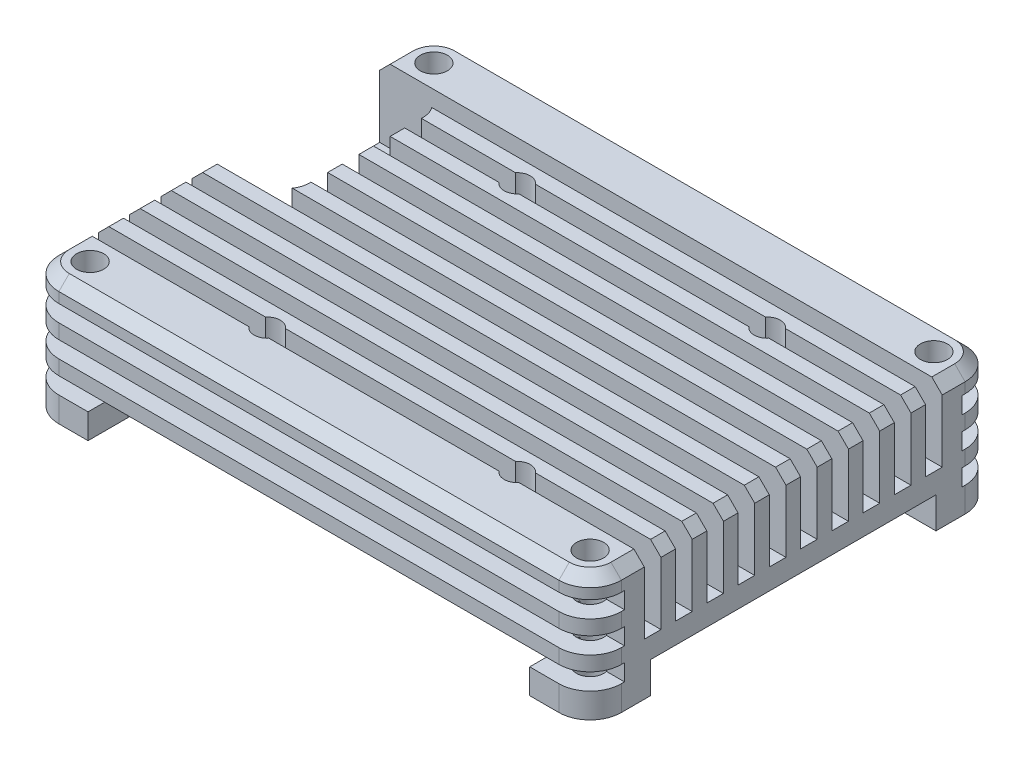
from build123d import *

# Parameters (mm, degrees)
SKIZZE1_W                         = 5.8
SKIZZE1_H                         = 5.8
AUFSATZ_LINEAR_AUSTRAGEN1_DEPTH   = 3
AUFSATZ_LINEAR_AUSTRAGEN1_2_DEPTH = 3
AUFSATZ_LINEAR_AUSTRAGEN1_3_DEPTH = 3
AUFSATZ_LINEAR_AUSTRAGEN1_4_DEPTH = 3
SKIZZE1_4_W                       = 15
SKIZZE1_4_H                       = 15
SKIZZE1_4_W_2                     = 10
SKIZZE1_4_W_3                     = 5.8
SKIZZE1_4_H_2                     = 5.8
AUFSATZ_LINEAR_AUSTRAGEN2_DEPTH   = 9
SKIZZE1_5_W                       = 10
SKIZZE1_5_H                       = 15
AUFSATZ_LINEAR_AUSTRAGEN3_DEPTH   = 2.2
SKIZZE1_6_W                       = 15
SKIZZE1_6_H                       = 15
AUFSATZ_LINEAR_AUSTRAGEN4_DEPTH   = 0.4
F_2_6_2_6_DURCHMESSER_BOHRUNG1_D  = 2.6
VERRUNDUNG1_R                     = 2
SKIZZE6_W                         = 1.6
SKIZZE6_H                         = 7
SKIZZE6_W_2                       = 3.3
SKIZZE6_H_2                       = 1.6
SCHNITT_LINEAR_AUSTRAGEN2_DEPTH   = 59.653644388
VERRUNDUNG2_R                     = 3
FASE1_SIZE                        = 1


# Read off the part's stored shape, not the designer's step: M3 Gewindebohrung2
with BuildPart() as part:
    # Skizze1 → Aufsatz-Linear austragen1 (new body)
    with BuildSketch(Plane(origin=(0, 3, 0), x_dir=(1, 0, 0), z_dir=(0, 1, 0))):
        with Locations((-24.1, -16.6)):
            Rectangle(SKIZZE1_W, SKIZZE1_H)
    extrude(amount=-AUFSATZ_LINEAR_AUSTRAGEN1_DEPTH)



with BuildPart() as body_2:
    # Skizze1 → Aufsatz-Linear austragen1 2 (new body)
    with BuildSketch(Plane(origin=(0, 3, 0), x_dir=(1, 0, 0), z_dir=(0, 1, 0))):
        with Locations((-24.1, 16.6)):
            Rectangle(SKIZZE1_W, SKIZZE1_H)
    extrude(amount=-AUFSATZ_LINEAR_AUSTRAGEN1_2_DEPTH)


with BuildPart() as body_3:
    # Skizze1 → Aufsatz-Linear austragen1 3 (new body)
    with BuildSketch(Plane(origin=(0, 3, 0), x_dir=(1, 0, 0), z_dir=(0, 1, 0))):
        with Locations((24.1, 16.6)):
            Rectangle(SKIZZE1_W, SKIZZE1_H)
    extrude(amount=-AUFSATZ_LINEAR_AUSTRAGEN1_3_DEPTH)


with BuildPart() as body_4:
    # Skizze1 → Aufsatz-Linear austragen1 4 (new body)
    with BuildSketch(Plane(origin=(0, 3, 0), x_dir=(1, 0, 0), z_dir=(0, 1, 0))):
        with Locations((24.1, -16.6)):
            Rectangle(SKIZZE1_W, SKIZZE1_H)
    extrude(amount=-AUFSATZ_LINEAR_AUSTRAGEN1_4_DEPTH)


with BuildPart() as part_1:
    add(part.part)

    add(body_2.part)  # Aufsatz-Linear austragen2 merges body 2

    add(body_3.part)  # Aufsatz-Linear austragen2 merges body 3

    add(body_4.part)  # Aufsatz-Linear austragen2 merges body 4
    # Skizze1<4> → Aufsatz-Linear austragen2 (add)
    # profile 1 of 7: a face of its own
    with BuildSketch(Plane(origin=(0, 3, 0), x_dir=(1, 0, 0), z_dir=(0, 1, 0))):
        Polygon((21.2, 13.7), (21.2, 19.5), (-21.2, 19.5), (-21.2, 13.7), (-27, 13.7), (-27, 13.5), (-20, 13.5), (-20, -1.5), (-27, -1.5), (-27, -13.7), (-21.2, -13.7), (-21.2, -19.5), (21.2, -19.5), (21.2, -13.7), (27, -13.7), (27, 13.7), align=None)
        with Locations((4.3, -3)):
            Rectangle(SKIZZE1_4_W, SKIZZE1_4_H, mode=Mode.SUBTRACT)
        with Locations((19.5, -3)):
            Rectangle(SKIZZE1_4_W_2, SKIZZE1_4_H, mode=Mode.SUBTRACT)
    # profile 2 of 7: a face of its own
    with BuildSketch(Plane(origin=(0, 3, 0), x_dir=(1, 0, 0), z_dir=(0, 1, 0))):
        with Locations((-24.1, -16.6)):
            Rectangle(SKIZZE1_4_W_3, SKIZZE1_4_H_2)
    # profile 3 of 7: a face of its own
    with BuildSketch(Plane(origin=(0, 3, 0), x_dir=(1, 0, 0), z_dir=(0, 1, 0))):
        with Locations((24.1, -16.6)):
            Rectangle(SKIZZE1_4_W_3, SKIZZE1_4_H_2)
    # profile 4 of 7: a face of its own
    with BuildSketch(Plane(origin=(0, 3, 0), x_dir=(1, 0, 0), z_dir=(0, 1, 0))):
        with Locations((24.1, 16.6)):
            Rectangle(SKIZZE1_4_W_3, SKIZZE1_4_H_2)
    # profile 5 of 7: a face of its own
    with BuildSketch(Plane(origin=(0, 3, 0), x_dir=(1, 0, 0), z_dir=(0, 1, 0))):
        with Locations((4.3, -3)):
            Rectangle(SKIZZE1_4_W, SKIZZE1_4_H)
    # profile 6 of 7: a face of its own
    with BuildSketch(Plane(origin=(0, 3, 0), x_dir=(1, 0, 0), z_dir=(0, 1, 0))):
        with Locations((19.5, -3)):
            Rectangle(SKIZZE1_4_W_2, SKIZZE1_4_H)
    # profile 7 of 7: a face of its own
    with BuildSketch(Plane(origin=(0, 3, 0), x_dir=(1, 0, 0), z_dir=(0, 1, 0))):
        with Locations((-24.1, 16.6)):
            Rectangle(SKIZZE1_4_W_3, SKIZZE1_4_H_2)
    extrude(amount=AUFSATZ_LINEAR_AUSTRAGEN2_DEPTH)

    # Skizze1<5> → Aufsatz-Linear austragen3 (add)
    with BuildSketch(Plane(origin=(0, 3, 0), x_dir=(1, 0, 0), z_dir=(0, 1, 0))):
        with Locations((19.5, -3)):
            Rectangle(SKIZZE1_5_W, SKIZZE1_5_H)
    extrude(amount=-AUFSATZ_LINEAR_AUSTRAGEN3_DEPTH)

    # Skizze1<6> → Aufsatz-Linear austragen4 (add)
    with BuildSketch(Plane(origin=(0, 3, 0), x_dir=(1, 0, 0), z_dir=(0, 1, 0))):
        with Locations((4.3, -3)):
            Rectangle(SKIZZE1_6_W, SKIZZE1_6_H)
    extrude(amount=-AUFSATZ_LINEAR_AUSTRAGEN4_DEPTH)

    # Ø2.6 (2.6) Durchmesser Bohrung1 (through all)
    with Locations(Plane(origin=(0, 12, 0), x_dir=(1, 0, 0), z_dir=(0, 1, 0))):
        with Locations((-24, 16.5), (24, 16.5), (24, -16.5), (-24, -16.5)):
            Hole(F_2_6_2_6_DURCHMESSER_BOHRUNG1_D / 2)

    # Verrundung1
    verrundung1_edges = [part_1.edges().sort_by_distance(p)[0] for p in [
        (-21.2, 1.5, 13.7),
        (-20, 7.5, -13.5),
        (-20, 7.5, 1.5),
        (-21.2, 1.5, -13.7),
        (21.2, 1.5, -13.7),
        (21.2, 1.5, 13.7),
    ]]
    fillet(verrundung1_edges, radius=VERRUNDUNG1_R)

    # Skizze6 → Schnitt-Linear austragen2 (cut, through all)
    with BuildSketch(Plane(origin=(27, 0, 0), x_dir=(0, 0, -1), z_dir=(1, 0, 0))):
        with Locations((-13.5, 8.5)):
            Rectangle(SKIZZE6_W, SKIZZE6_H)
        with Locations((-10.5, 8.5)):
            Rectangle(SKIZZE6_W, SKIZZE6_H)
        with Locations((-7.5, 8.5)):
            Rectangle(SKIZZE6_W, SKIZZE6_H)
        with Locations((-4.5, 8.5)):
            Rectangle(SKIZZE6_W, SKIZZE6_H)
        with Locations((-1.5, 8.5)):
            Rectangle(SKIZZE6_W, SKIZZE6_H)
        with Locations((1.5, 8.5)):
            Rectangle(SKIZZE6_W, SKIZZE6_H)
        with Locations((4.5, 8.5)):
            Rectangle(SKIZZE6_W, SKIZZE6_H)
        with Locations((7.5, 8.5)):
            Rectangle(SKIZZE6_W, SKIZZE6_H)
        with Locations((10.5, 8.5)):
            Rectangle(SKIZZE6_W, SKIZZE6_H)
        with Locations((13.5, 8.5)):
            Rectangle(SKIZZE6_W, SKIZZE6_H)
        with Locations((17.85, 9.2)):
            Rectangle(SKIZZE6_W_2, SKIZZE6_H_2)
        with Locations((-17.85, 9.2)):
            Rectangle(SKIZZE6_W_2, SKIZZE6_H_2)
        with Locations((17.85, 6.2)):
            Rectangle(SKIZZE6_W_2, SKIZZE6_H_2)
        with Locations((17.85, 3.2)):
            Rectangle(SKIZZE6_W_2, SKIZZE6_H_2)
        with Locations((-17.85, 6.2)):
            Rectangle(SKIZZE6_W_2, SKIZZE6_H_2)
        with Locations((-17.85, 3.2)):
            Rectangle(SKIZZE6_W_2, SKIZZE6_H_2)
    extrude(amount=-SCHNITT_LINEAR_AUSTRAGEN2_DEPTH, mode=Mode.SUBTRACT)

    # Verrundung2
    verrundung2_edges = [part_1.edges().sort_by_distance(p)[0] for p in [
        (-27, 1.2, 19.5),
        (-27, 7.7, -19.5),
        (-27, 4.7, -19.5),
        (-27, 1.2, -19.5),
        (27, 7.7, -19.5),
        (27, 4.7, -19.5),
        (27, 1.2, -19.5),
        (27, 7.7, 19.5),
        (27, 4.7, 19.5),
        (27, 1.2, 19.5),
        (27, 11, 19.5),
        (27, 11, -19.5),
        (-27, 11, -19.5),
        (-27, 4.7, 19.5),
        (-27, 7.7, 19.5),
        (-27, 11, 19.5),
    ]]
    fillet(verrundung2_edges, radius=VERRUNDUNG2_R)

    # Fase1
    fase1_edges = [part_1.edges().sort_by_distance(p)[0] for p in [
        (27, 12, 12),
        (27, 12, 9),
        (27, 12, 6),
        (27, 12, 3),
        (27, 12, 0),
        (27, 12, -3),
        (27, 12, -6),
        (27, 12, -9),
        (27, 12, -12),
        (27, 12, -15.4),
        (-27, 12, -15.4),
        (-27, 12, 12),
        (-27, 12, 9),
        (-27, 12, 6),
        (-27, 12, 3),
        (0, 12, -19.5),
        (27, 12, 15.4),
        (-26.121320344, 12, -18.621320344),
        (26.121320344, 12, -18.621320344),
        (0, 12, 19.5),
        (-27, 12, 15.4),
        (-26.121320344, 12, 18.621320344),
        (26.121320344, 12, 18.621320344),
    ]]
    chamfer(fase1_edges, length=FASE1_SIZE)

    # M3 Gewindebohrung2 outline → M3 Gewindebohrung2 (revolve, cut)
    with BuildSketch(Plane(origin=(-10, 0, 13.5), x_dir=(1, 0, 0), z_dir=(0, 0, 1))):
        Polygon((0, 4.248924226), (1.25, 5), (1.25, 12), (0, 12), align=None)
    revolve(axis=Axis((-10, 0, 13.5), (0, 1, 0)), mode=Mode.SUBTRACT)

    # M3 Gewindebohrung2 2 outline → M3 Gewindebohrung2 2 (revolve, cut)
    with BuildSketch(Plane(origin=(14, 0, 13.5), x_dir=(1, 0, 0), z_dir=(0, 0, 1))):
        Polygon((0, 4.248924226), (1.25, 5), (1.25, 12), (0, 12), align=None)
    revolve(axis=Axis((14, 0, 13.5), (0, 1, 0)), mode=Mode.SUBTRACT)

    # M3 Gewindebohrung2 3 outline → M3 Gewindebohrung2 3 (revolve, cut)
    with BuildSketch(Plane(origin=(14, 0, -10.5), x_dir=(1, 0, 0), z_dir=(0, 0, 1))):
        Polygon((0, 4.248924226), (1.25, 5), (1.25, 12), (0, 12), align=None)
    revolve(axis=Axis((14, 0, -10.5), (0, 1, 0)), mode=Mode.SUBTRACT)

    # M3 Gewindebohrung2 4 outline → M3 Gewindebohrung2 4 (revolve, cut)
    with BuildSketch(Plane(origin=(-10, 0, -10.5), x_dir=(1, 0, 0), z_dir=(0, 0, 1))):
        Polygon((0, 4.248924226), (1.25, 5), (1.25, 12), (0, 12), align=None)
    revolve(axis=Axis((-10, 0, -10.5), (0, 1, 0)), mode=Mode.SUBTRACT)


solid = part_1.part
